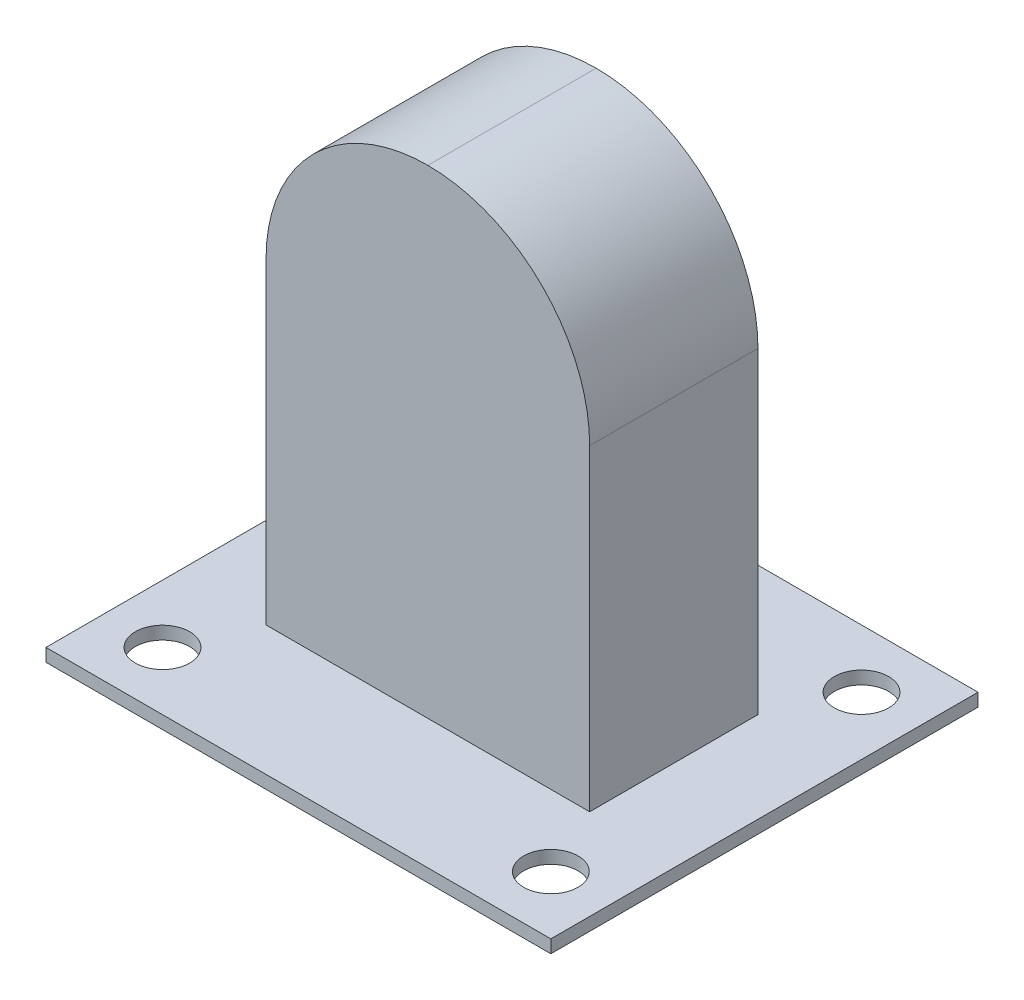
from build123d import *

# Parameters (mm, degrees)
SKETCH_1_W      = 39
SKETCH_1_H      = 33
SKETCH_1_R      = 2.1
EXTRUDE_1_DEPTH = 1
SKETCH_2_W      = 25
SKETCH_2_H      = 37
EXTRUDE_2_DEPTH = 6.5
FILLET_1_R      = 12.5


with BuildPart() as part:
    # 草图1 → 凸台-拉伸1 (new body)
    with BuildSketch(Plane(origin=(0, 0, 0), x_dir=(1, 0, 0), z_dir=(0, 1, 0))):
        Rectangle(SKETCH_1_W, SKETCH_1_H)
        with Locations(Location((-15, 12, 0), (0, 0, 270))):
            Circle(SKETCH_1_R, mode=Mode.SUBTRACT)
        with Locations(Location((15, 12, 0), (0, 0, 90))):
            Circle(SKETCH_1_R, mode=Mode.SUBTRACT)
        with Locations(Location((15, -12, 0), (0, 0, 270))):
            Circle(SKETCH_1_R, mode=Mode.SUBTRACT)
        with Locations(Location((-15, -12, 0), (0, 0, 90))):
            Circle(SKETCH_1_R, mode=Mode.SUBTRACT)
    extrude(amount=EXTRUDE_1_DEPTH)

    # 草图2 → 凸台-拉伸2 (add, symmetric)
    with BuildSketch(Plane.XY):
        with Locations((0, 19.5)):
            Rectangle(SKETCH_2_W, SKETCH_2_H)
    extrude(amount=EXTRUDE_2_DEPTH, both=True)

    # 圆角1
    fillet_1_edges = [part.edges().sort_by_distance(p)[0] for p in [
        (-12.5, 38, 0),
        (12.5, 38, 0),
    ]]
    fillet(fillet_1_edges, radius=FILLET_1_R - 0.0001)  # a hair under: the kernel refuses the full size


solid = part.part
